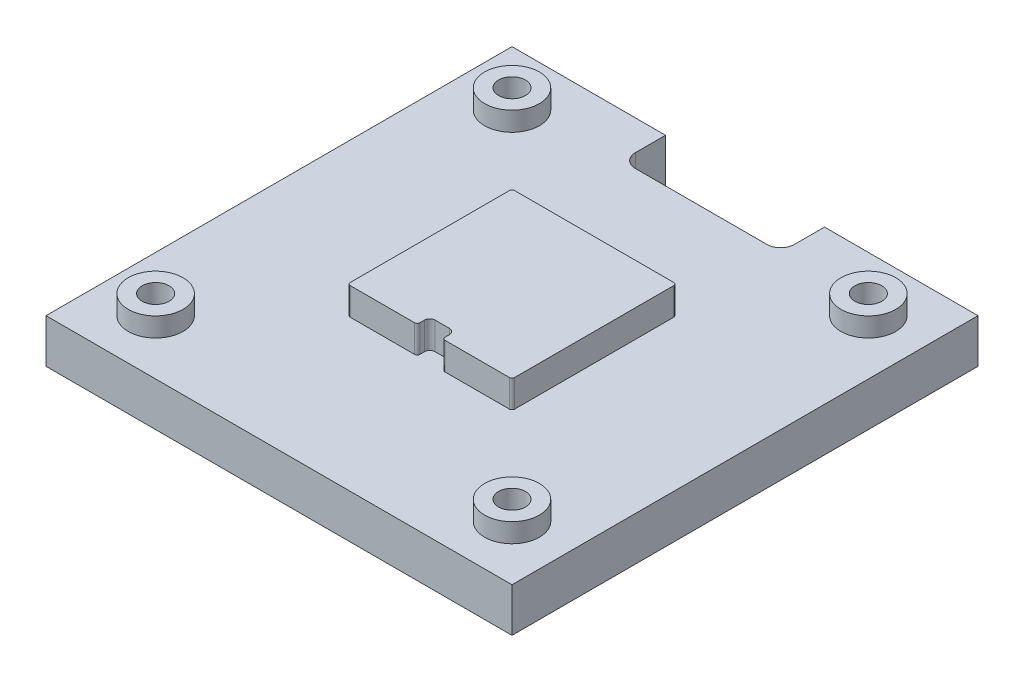
from build123d import *

# Parameters (mm, degrees)
SKETCH1_W           = 85
SKETCH1_H           = 85
SKETCH1_R           = 2.4575
BOSS_EXTRUDE1_DEPTH = 8
SKETCH2_R           = 3.969
CUT_EXTRUDE1_DEPTH  = 4.166
SKETCH3_R           = 5
SKETCH3_R_2         = 2.4575
BOSS_EXTRUDE2_DEPTH = 3.5
BOSS_EXTRUDE3_DEPTH = 5
SKETCH5_W           = 29
SKETCH5_H           = 8
CUT_EXTRUDE2_DEPTH  = 10
FILLET1_R           = 2.5


with BuildPart() as part:
    # Sketch1 → Boss-Extrude1 (new body)
    with BuildSketch(Plane(origin=(0, 0, 0), x_dir=(1, 0, 0), z_dir=(0, 1, 0))):
        Rectangle(SKETCH1_W, SKETCH1_H)
        with Locations((-32.5, 32.5)):
            Circle(SKETCH1_R, mode=Mode.SUBTRACT)
        with Locations((-32.5, -32.5)):
            Circle(SKETCH1_R, mode=Mode.SUBTRACT)
        with Locations((32.5, -32.5)):
            Circle(SKETCH1_R, mode=Mode.SUBTRACT)
        with Locations((32.5, 32.5)):
            Circle(SKETCH1_R, mode=Mode.SUBTRACT)
    extrude(amount=BOSS_EXTRUDE1_DEPTH)

    # Sketch2 → Cut-Extrude1 (cut)
    with BuildSketch(Plane.XZ):
        with Locations((-32.5, 32.5)):
            Circle(SKETCH2_R)
        with Locations((32.5, 32.5)):
            Circle(SKETCH2_R)
        with Locations((32.5, -32.5)):
            Circle(SKETCH2_R)
        with Locations((-32.5, -32.5)):
            Circle(SKETCH2_R)
    extrude(amount=-CUT_EXTRUDE1_DEPTH, mode=Mode.SUBTRACT)

    # Sketch3 → Boss-Extrude2 (add)
    # profile 1 of 4: a face of its own
    with BuildSketch(Plane(origin=(0, 8, 0), x_dir=(1, 0, 0), z_dir=(0, 1, 0))):
        with Locations((32.5, -32.5)):
            Circle(SKETCH3_R)
        with Locations((32.5, -32.5)):
            Circle(SKETCH3_R_2, mode=Mode.SUBTRACT)
    # profile 2 of 4: a face of its own
    with BuildSketch(Plane(origin=(0, 8, 0), x_dir=(1, 0, 0), z_dir=(0, 1, 0))):
        with Locations((-32.5, -32.5)):
            Circle(SKETCH3_R)
        with Locations((-32.5, -32.5)):
            Circle(SKETCH3_R_2, mode=Mode.SUBTRACT)
    # profile 3 of 4: a face of its own
    with BuildSketch(Plane(origin=(0, 8, 0), x_dir=(1, 0, 0), z_dir=(0, 1, 0))):
        with Locations((-32.5, 32.5)):
            Circle(SKETCH3_R)
        with Locations((-32.5, 32.5)):
            Circle(SKETCH3_R_2, mode=Mode.SUBTRACT)
    # profile 4 of 4: a face of its own
    with BuildSketch(Plane(origin=(0, 8, 0), x_dir=(1, 0, 0), z_dir=(0, 1, 0))):
        with Locations((32.5, 32.5)):
            Circle(SKETCH3_R)
        with Locations((32.5, 32.5)):
            Circle(SKETCH3_R_2, mode=Mode.SUBTRACT)
    extrude(amount=BOSS_EXTRUDE2_DEPTH)

    # Sketch4 → Boss-Extrude3 (add)
    with BuildSketch(Plane(origin=(0, 8, 0), x_dir=(1, 0, 0), z_dir=(0, 1, 0))):
        with BuildLine():
            Line((2.2929, -14.5), (2.2929, -13.7071))
            ThreePointArc((2.2929, -13.7071), (2.000006781, -12.999993219), (1.2929, -12.7071))
            Line((1.2929, -12.7071), (-1.2929, -12.7071))
            ThreePointArc((-1.2929, -12.7071), (-2.000006781, -12.999993219), (-2.2929, -13.7071))
            Line((-2.2929, -13.7071), (-2.2929, -14.5))
            ThreePointArc((-2.2929, -14.5), (-2.439346609, -14.853553391), (-2.7929, -15))
            Line((-2.7929, -15), (-14.5, -15))
            ThreePointArc((-14.5, -15), (-14.853553391, -14.853553391), (-15, -14.5))
            Line((-15, -14.5), (-15, 14.5))
            ThreePointArc((-15, 14.5), (-14.853553391, 14.853553391), (-14.5, 15))
            Line((-14.5, 15), (14.5, 15))
            ThreePointArc((14.5, 15), (14.853553391, 14.853553391), (15, 14.5))
            Line((15, 14.5), (15, -14.5))
            ThreePointArc((15, -14.5), (14.853553391, -14.853553391), (14.5, -15))
            Line((14.5, -15), (2.7929, -15))
            ThreePointArc((2.7929, -15), (2.439346609, -14.853553391), (2.2929, -14.5))
        make_face()
    extrude(amount=BOSS_EXTRUDE3_DEPTH)

    # Sketch5 → Cut-Extrude2 (cut)
    with BuildSketch(Plane(origin=(0, 8, 0), x_dir=(1, 0, 0), z_dir=(0, 1, 0))):
        with Locations((0, 38.5)):
            Rectangle(SKETCH5_W, SKETCH5_H)
    extrude(amount=-CUT_EXTRUDE2_DEPTH, mode=Mode.SUBTRACT)

    # Fillet1
    fillet1_edges = [part.edges().sort_by_distance(p)[0] for p in [
        (-14.5, 4, -34.5),
        (14.5, 4, -34.5),
    ]]
    fillet(fillet1_edges, radius=FILLET1_R)


solid = part.part
